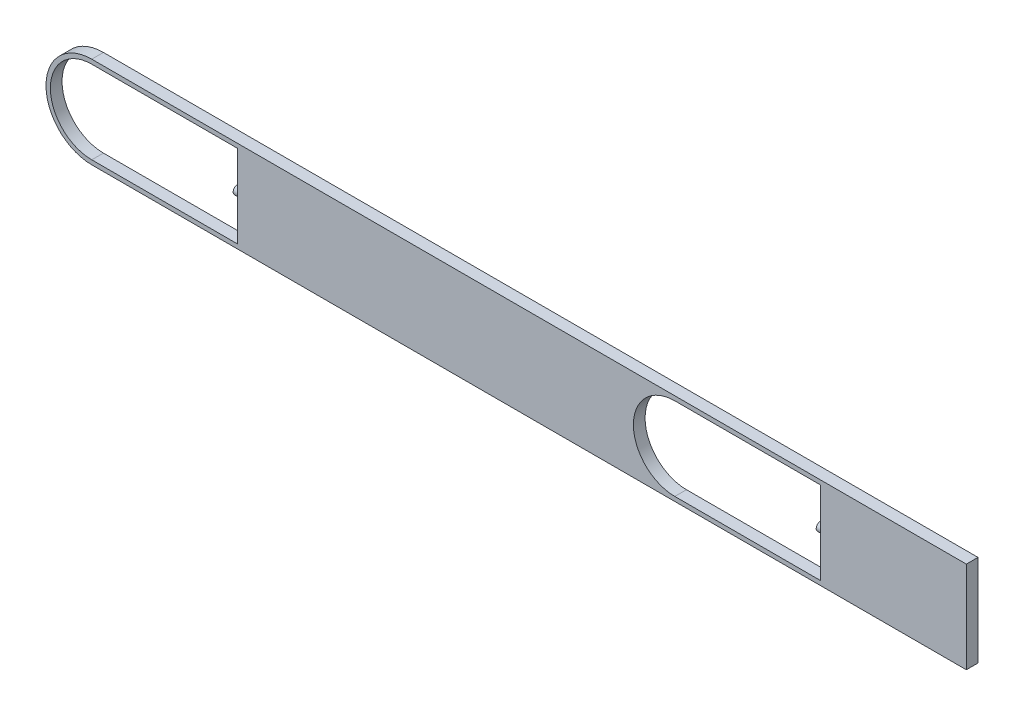
from build123d import *

# Parameters (mm, degrees)
SKETCH1_R                = 19.939
CIRCLE_EXTRUDE_DEPTH     = 5.08
SKETCH3_W                = 5.08
SKETCH3_H                = 39.878
RECTANGLE_EXTRUDE_DEPTH  = 127
SKETCH2_R                = 18.034
CIRCLE_CUT_DEPTH         = 129.65601471
SKETCH6_W                = 125.095
SKETCH6_H                = 36.068
RECTANGLE_CUT_DEPTH      = 129.65601471
SKETCH7_W                = 61.595
SKETCH7_H                = 36.068
END_SHAPE_DEPTH          = 5.08
SKETCH8_R                = 1.905
FOR_SPRING_EXTRUDE_DEPTH = 2.54
MIRRORED_PATTERN_COUNT   = 2
MIRRORED_PATTERN_PITCH   = 254
BOSS_EXTRUDE1_REACH      = 256.832
SKETCH10_W               = 5.08
SKETCH10_H               = 39.878


with BuildPart() as part:
    # Sketch1 → circle extrude (new body)
    with BuildSketch(Plane.XY):
        Circle(SKETCH1_R)
    extrude(amount=CIRCLE_EXTRUDE_DEPTH)

    # Sketch3 → rectangle extrude (add)
    with BuildSketch(Plane(origin=(0, 0, 0), x_dir=(0, 0, -1), z_dir=(1, 0, 0))):
        with Locations((-2.54, 0)):
            Rectangle(SKETCH3_W, SKETCH3_H)
    extrude(amount=RECTANGLE_EXTRUDE_DEPTH)

    # Sketch2 → circle cut (cut, through all)
    with BuildSketch(Plane.XY.offset(5.08)):
        Circle(SKETCH2_R)
    extrude(amount=-CIRCLE_CUT_DEPTH, mode=Mode.SUBTRACT)

    # Sketch6 → rectangle cut (cut, through all)
    with BuildSketch(Plane.XY.offset(5.08)):
        with Locations((62.5475, 0)):
            Rectangle(SKETCH6_W, SKETCH6_H)
    extrude(amount=-RECTANGLE_CUT_DEPTH, mode=Mode.SUBTRACT)

    # Sketch7 → end shape (add)
    with BuildSketch(Plane.XY.offset(5.08)):
        with Locations((94.2975, 0)):
            Rectangle(SKETCH7_W, SKETCH7_H)
    extrude(amount=-END_SHAPE_DEPTH)

    # Sketch8 → for spring extrude (add)
    with BuildSketch(Plane.ZY.offset(-63.5)):
        with Locations((2.54, 0)):
            Circle(SKETCH8_R)
    extrude(amount=FOR_SPRING_EXTRUDE_DEPTH)


with BuildPart() as mirrored_pattern_1:
    # mirrored pattern: pattern copy
    add(part.part.moved(Location(Vector(1, 0, 0) * (1 * MIRRORED_PATTERN_PITCH))))

    # Sketch10 → Boss-Extrude1 (add, up to next)
    with BuildSketch(Plane(origin=(127, 0, 0), x_dir=(0, 0, -1), z_dir=(1, 0, 0)), mode=Mode.PRIVATE) as boss_extrude1_sk1:
        with Locations((-2.54, 0)):
            Rectangle(SKETCH10_W, SKETCH10_H)
    boss_extrude1_tool1 = extrude(boss_extrude1_sk1.sketch, amount=BOSS_EXTRUDE1_REACH, mode=Mode.PRIVATE) - mirrored_pattern_1.part

    add(part.part)  # Boss-Extrude1 merges part
    add(boss_extrude1_tool1.solids().sort_by_distance((127, 0, 2.54))[0])


solid = mirrored_pattern_1.part
